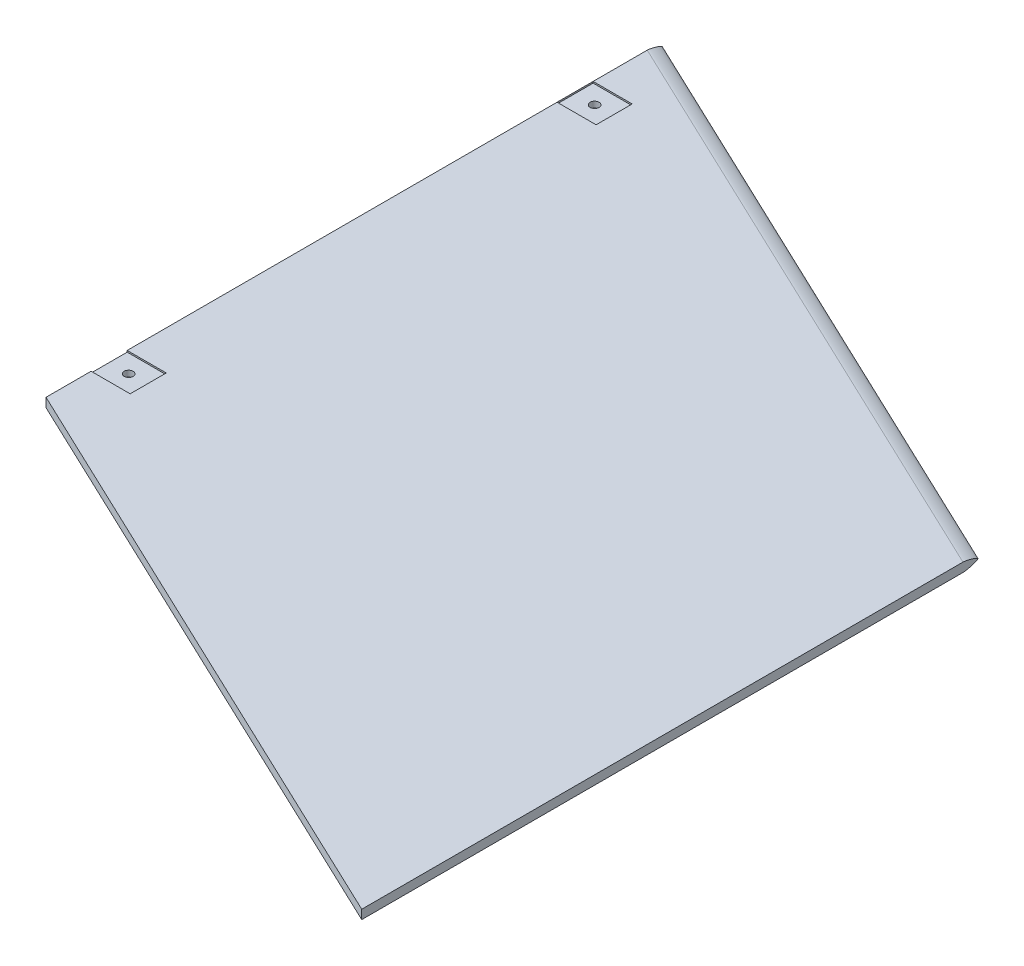
from build123d import *
from OCP.BRepAlgoAPI import BRepAlgoAPI_Cut
from OCP.TopTools import TopTools_ListOfShape

# Parameters (mm, degrees)
BOSS_EXTRUDE1_DEPTH = 1.5
SKETCH4_W           = 13
SKETCH4_H           = 12
CUT_EXTRUDE1_DEPTH  = 0.5
SKETCH5_R           = 1.5
CUT_EXTRUDE2_DEPTH  = 287.410981077


with BuildPart() as part:
    # Sketch1 → Boss-Extrude1 (new, symmetric)
    with BuildSketch(Plane(origin=(0, 0, 0), x_dir=(1, 0, 0), z_dir=(0, 1, 0))):
        Polygon((0, 200), (0, 0), (200, -94.966982203), (200, 105.033017797), align=None)
    extrude(amount=BOSS_EXTRUDE1_DEPTH, both=True)

    # Sweep1: sweep along a curve in space
    with BuildLine() as sweep1_path:
        Line((200, 1.5, -105.033017797), (0, 1.5, -200))
    # Sketch3 → Sweep1 (sweep)
    with BuildSketch(Plane.ZY):
        with BuildLine():
            Line((-200, 1.5), (-200, -1.5))
            add(Edge.make_bspline(
                [(-205, 0), (-204.999655032, -0.001572402), (-204.998878933, -0.003888658), (-204.997155713, -0.007342165), (-204.994010432, -0.012755742), (-204.989231423, -0.019785677), (-204.980675728, -0.030668763), (-204.965618044, -0.047194795), (-204.939702421, -0.071829754), (-204.896292479, -0.107664707), (-204.82573528, -0.158417257), (-204.723075855, -0.22306849), (-204.559991461, -0.314199851), (-204.34111527, -0.421621397), (-204.076984601, -0.537161886), (-203.77427994, -0.656272258), (-203.468191645, -0.766325117), (-203.082217168, -0.894127627), (-202.614592161, -1.033453165), (-202.142498997, -1.156935753), (-201.666656772, -1.264868805), (-201.267793728, -1.343684576), (-200.9473473, -1.399461144), (-200.625557153, -1.446966666), (-200.348383248, -1.478986725), (-200.151300051, -1.494719463), (-200.035035431, -1.499627949), (-200, -1.5)],
                knots=[0, 0, 0, 0, 0, 0.001215267, 0.001853198, 0.002906914, 0.004743177, 0.007642996, 0.012327914, 0.019818398, 0.031794086, 0.05022871, 0.078089308, 0.111622418, 0.173183188, 0.234743992, 0.296304811, 0.357865625, 0.419426433, 0.542548067, 0.665669704, 0.727230523, 0.78879134, 0.850352159, 0.911912976, 0.973473795, 1, 1, 1, 1, 1], degree=4))
            add(Edge.make_bspline(
                [(-205, 0), (-204.999655032, 0.001572402), (-204.998878933, 0.003888658), (-204.997155713, 0.007342165), (-204.994010432, 0.012755742), (-204.989231423, 0.019785677), (-204.980675728, 0.030668763), (-204.965618044, 0.047194795), (-204.939702421, 0.071829754), (-204.896292479, 0.107664707), (-204.82573528, 0.158417257), (-204.723075855, 0.22306849), (-204.559991461, 0.314199851), (-204.34111527, 0.421621397), (-204.076984601, 0.537161886), (-203.77427994, 0.656272258), (-203.468191645, 0.766325117), (-203.082217168, 0.894127627), (-202.614592161, 1.033453165), (-202.142498997, 1.156935753), (-201.666656772, 1.264868805), (-201.267793728, 1.343684576), (-200.9473473, 1.399461144), (-200.625557153, 1.446966666), (-200.348383248, 1.478986725), (-200.151300051, 1.494719463), (-200.035035431, 1.499627949), (-200, 1.5)],
                knots=[0, 0, 0, 0, 0, 0.001215267, 0.001853198, 0.002906914, 0.004743177, 0.007642996, 0.012327914, 0.019818398, 0.031794086, 0.05022871, 0.078089308, 0.111622418, 0.173183188, 0.234743992, 0.296304811, 0.357865625, 0.419426433, 0.542548067, 0.665669704, 0.727230523, 0.78879134, 0.850352159, 0.911912976, 0.973473795, 1, 1, 1, 1, 1], degree=4))
        make_face()
    sweep(path=sweep1_path.line)


with BuildPart() as cut_extrude1_tool:
    # Sketch4 → Cut-Extrude1 (new body)
    with BuildSketch(Plane(origin=(0, 1.5, 0), x_dir=(1, 0, 0), z_dir=(0, 1, 0))):
        with Locations((6.500105483, 175.99994496)):
            Rectangle(SKETCH4_W, SKETCH4_H)
        with Locations((6.500008694, 21)):
            Rectangle(SKETCH4_W, SKETCH4_H)
    cut_extrude1 = extrude(amount=-CUT_EXTRUDE1_DEPTH)


with BuildPart() as part_1:
    add(part.part)

    # Cut-Extrude1: cut by cut_extrude1_tool, with a tolerance
    cut_extrude1_stock = TopTools_ListOfShape()
    cut_extrude1_stock.Append(part_1.part.wrapped)
    cut_extrude1_tools = TopTools_ListOfShape()
    cut_extrude1_tools.Append(cut_extrude1_tool.part.wrapped)
    cut_extrude1_cut = BRepAlgoAPI_Cut()
    cut_extrude1_cut.SetArguments(cut_extrude1_stock)
    cut_extrude1_cut.SetTools(cut_extrude1_tools)
    cut_extrude1_cut.SetFuzzyValue(0.00001)
    cut_extrude1_cut.Build()
    add(Compound.cast(cut_extrude1_cut.Shape()).solids(), mode=Mode.REPLACE)

    # Sketch5 → Cut-Extrude2 (cut, through all)
    with BuildSketch(Plane(origin=(0, 1, 0), x_dir=(1, 0, 0), z_dir=(0, 1, 0))):
        with Locations(Location((6.500105483, 175.99994496, 0), (0, 0, 270))):
            Circle(SKETCH5_R)
        with Locations(Location((6.500008694, 21, 0), (0, 0, 270))):
            Circle(SKETCH5_R)
    extrude(amount=-CUT_EXTRUDE2_DEPTH, mode=Mode.SUBTRACT)

    # Mirror1: Cut-Extrude1 across plane
    add(cut_extrude1.mirror(Plane.ZX), mode=Mode.SUBTRACT)


solid = part_1.part
